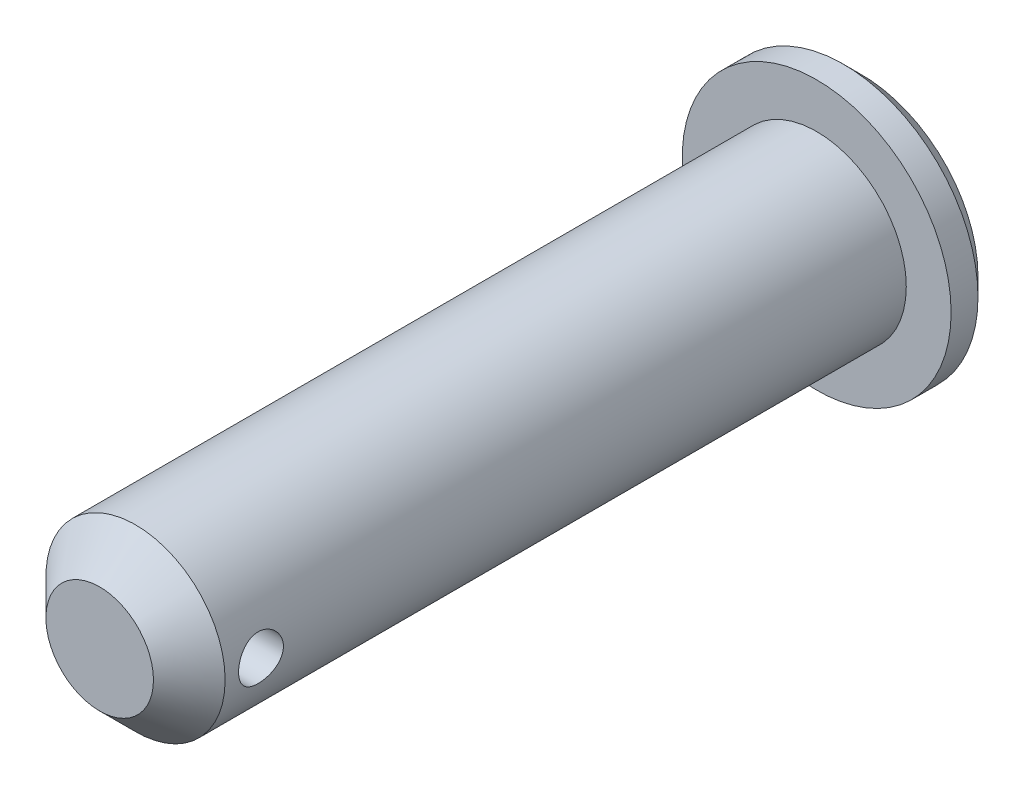
from build123d import *

# Parameters (mm, degrees)
SKETCH1_R               = 15
BASE_EXTRUDE_DEPTH      = 5
CHAMFER1_2_OUTLINE_W    = 10
CHAMFER1_2_OUTLINE_H    = 80
CHAMFER2_SIZE           = 4
CUT_EXTRUDE1_DEPTH      = 74.813887582
CUT_EXTRUDE1_DEPTH_BACK = 74.813887582
SKETCH3_R               = 2.5


with BuildPart() as part:
    # Sketch1 → Base-Extrude (new body)
    with BuildSketch(Plane.XY):
        Circle(SKETCH1_R)
    extrude(amount=-BASE_EXTRUDE_DEPTH)

    # Chamfer1: read off the stored shape, not the designer's step
    # Chamfer1 outline → Chamfer1 (revolve, cut)
    with BuildSketch(Plane.XZ):
        Polygon((15, -3), (13, -5), (15, -5), align=None)
    revolve(axis=Axis((0, 0, 0), (0, 0, 1)), mode=Mode.SUBTRACT)

    # Chamfer1 2 outline → Chamfer1 2 (revolve)
    with BuildSketch(Plane.XZ):
        with Locations((5, 40)):
            Rectangle(CHAMFER1_2_OUTLINE_W, CHAMFER1_2_OUTLINE_H)
    revolve(axis=Axis((0, 0, 0), (0, 0, 1)))

    # Chamfer2
    chamfer2_edges = [part.edges().sort_by_distance(p)[0] for p in [
        (-10, 0, 80),
    ]]
    chamfer(chamfer2_edges, length=CHAMFER2_SIZE)

    # Sketch3 → Cut-Extrude1 (cut, two sides: drawn at the far end of the back side and taken through both)
    with BuildSketch(Plane(origin=(0, 0, 9.3), x_dir=(0, -1, 0), z_dir=(1, 0, 0)).offset(-CUT_EXTRUDE1_DEPTH_BACK)):
        with Locations(Location((0, -62.7, 0), (0, 0, 270))):
            Circle(SKETCH3_R)
    extrude(amount=CUT_EXTRUDE1_DEPTH + CUT_EXTRUDE1_DEPTH_BACK, mode=Mode.SUBTRACT)


solid = part.part
